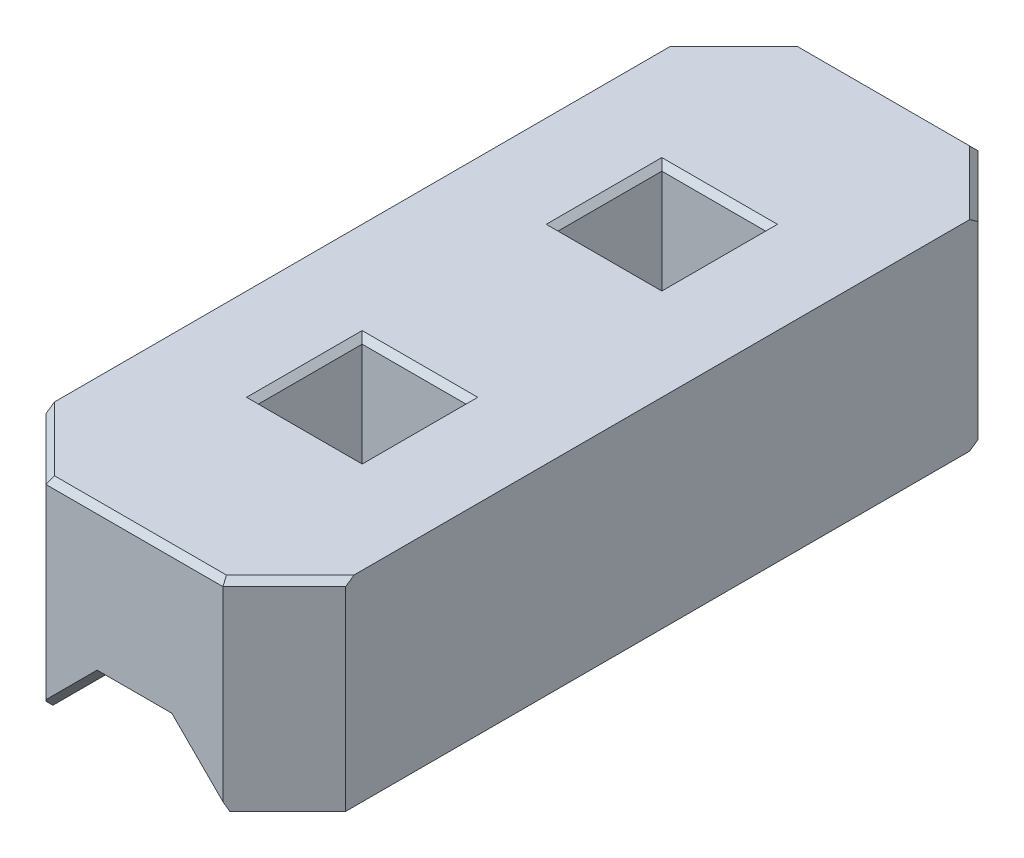
from build123d import *

# Parameters (mm, degrees)
SKETCH5_W           = 0.44
SKETCH5_H           = 0.44
BOSS_EXTRUDE1_DEPTH = 0.85
CUT_EXTRUDE1_REACH  = 5.371
CHAMFER1_SIZE       = 0.025


with BuildPart() as part:
    # Sketch5 → Boss-Extrude1 (new body)
    with BuildSketch(Plane(origin=(0, 0, 0), x_dir=(1, 0, 0), z_dir=(0, 1, 0))):
        Polygon((-0.375, 1.6), (0.375, 1.6), (0.635, 1.34), (0.635, -1.34), (0.375, -1.6), (-0.375, -1.6), (-0.635, -1.34), (-0.635, 1.34), align=None)
        with Locations((0, 0.635)):
            Rectangle(SKETCH5_W, SKETCH5_H, mode=Mode.SUBTRACT)
        with Locations((0, -0.635)):
            Rectangle(SKETCH5_W, SKETCH5_H, mode=Mode.SUBTRACT)
    extrude(amount=BOSS_EXTRUDE1_DEPTH)

    # Cut-Extrude1: up to this face of the body (flat: up to its plane)
    cut_extrude1_end = Plane(part.part.faces().sort_by_distance((0, 0.425, -1.6))[0])
    # Sketch6 → Cut-Extrude1 (cut, up to the picked face)
    with BuildSketch(Plane.XY.offset(1.6), mode=Mode.PRIVATE) as cut_extrude1_sk1:
        Polygon((-0.375, 0), (-0.148, 0.227), (0.148, 0.227), (0.375, 0), align=None)
    cut_extrude1_tool1 = split(extrude(cut_extrude1_sk1.sketch, amount=-CUT_EXTRUDE1_REACH, mode=Mode.PRIVATE), bisect_by=cut_extrude1_end, keep=Keep.BOTH, mode=Mode.PRIVATE)
    add(cut_extrude1_tool1.solids().sort_by(Axis((0, 0.097079, 1.6), (0, 0, -1)))[0], mode=Mode.SUBTRACT)

    # Chamfer1
    # the kernel refuses this chamfer: 0.025 mm, written as the material it takes off along each edge
    with BuildSketch(Plane(origin=(-0.329538638, 0, 1.645461362), x_dir=(0.7068394360706735, -0.027495876610586514, -0.7068394360706735), z_dir=(-0.7071067811865476, 0, -0.7071067811865476)), Plane(origin=(0.329538638, 0.85, -1.645461362), x_dir=(0.019442520806015277, -0.9996219169112966, -0.01944252080601526), z_dir=(0.7071067811865472, 0, 0.7071067811865479))) as chamfer1_piece_1:
        Polygon((CHAMFER1_SIZE * 0.999621916911, -CHAMFER1_SIZE * 0.0274958766106), (-CHAMFER1_SIZE * 0.0274958766106, -CHAMFER1_SIZE * 0.999621916911), (0, 0), align=None)
    extrude(amount=0.496279676, mode=Mode.SUBTRACT)
    with BuildSketch(Plane(origin=(-0.680461362, 0, -1.294538638), x_dir=(-0.01944252080601428, 0.9996219169112966, -0.019442520806014163), z_dir=(0.7071067811865455, 0, -0.7071067811865497)), Plane(origin=(-0.329538638, 0.85, 1.645461362), x_dir=(0.7068394360706735, 0.027495876610587406, -0.7068394360706735), z_dir=(-0.7071067811865476, 0, -0.7071067811865476)), Plane(origin=(0.680461362, 0.85, 1.294538638), x_dir=(-0.7068394360706735, 0.02749587661058749, -0.7068394360706735), z_dir=(-0.7071067811865476, 0, 0.7071067811865476)), Plane(origin=(-0.680461362, 0.85, -1.294538638), x_dir=(0.7068394360706755, 0.02749587661058732, 0.7068394360706715), z_dir=(0.7071067811865455, 0, -0.7071067811865497)), Plane(origin=(0.329538638, 0, -1.645461362), x_dir=(0.019442520806010995, 0.9996219169112968, -0.019442520806010978), z_dir=(0.7071067811865472, 0, 0.7071067811865479))) as chamfer1_piece_2:
        Polygon((CHAMFER1_SIZE * 0.999621916911, CHAMFER1_SIZE * 0.0274958766106), (-CHAMFER1_SIZE * 0.0274958766106, CHAMFER1_SIZE * 0.999621916911), (0, 0), align=None)
    extrude(amount=0.496279676, mode=Mode.SUBTRACT)
    with BuildSketch(Plane(origin=(0.439292075, 0.85, 1.6), x_dir=(0, 0.02749587661058742, -0.9996219169112966), z_dir=(-1, 0, 0))) as chamfer1_piece_3:
        Polygon((CHAMFER1_SIZE * 0.999621916911, CHAMFER1_SIZE * 0.0274958766106), (-CHAMFER1_SIZE * 0.0274958766106, CHAMFER1_SIZE * 0.999621916911), (0, 0), align=None)
    extrude(amount=0.878584149, mode=Mode.SUBTRACT)
    with BuildSketch(Plane(origin=(0.22, 0.85, -0.855), x_dir=(0.9996219169112966, 0.02749587661058736, 0), z_dir=(0, 0, 1)), Plane(origin=(-0.22, 0.85, -0.855), x_dir=(0, 0.027495876610587302, -0.9996219169112966), z_dir=(1, 0, 0)), Plane(origin=(-0.22, 0.85, -0.415), x_dir=(-0.9996219169112966, 0.02749587661058736, 0), z_dir=(0, 0, -1)), Plane(origin=(0.22, 0.85, -0.415), x_dir=(0, 0.027495876610587302, 0.9996219169112966), z_dir=(-1, 0, 0)), Plane(origin=(-0.22, 0.85, 0.855), x_dir=(-0.9996219169112966, 0.02749587661058736, 0), z_dir=(0, 0, -1)), Plane(origin=(0.22, 0.85, 0.855), x_dir=(0, 0.027495876610587302, 0.9996219169112966), z_dir=(-1, 0, 0)), Plane(origin=(0.22, 0.85, 0.415), x_dir=(0.9996219169112966, 0.02749587661058736, 0), z_dir=(0, 0, 1)), Plane(origin=(-0.22, 0.85, 0.415), x_dir=(0, 0.027495876610587302, -0.9996219169112966), z_dir=(1, 0, 0))) as chamfer1_piece_4:
        Polygon((CHAMFER1_SIZE * 0.999621916911, -CHAMFER1_SIZE * 0.0274958766106), (-CHAMFER1_SIZE * 0.0274958766106, -CHAMFER1_SIZE * 0.999621916911), (0, 0), align=None)
    extrude(amount=0.44, mode=Mode.SUBTRACT)
    with BuildSketch(Plane(origin=(-0.439292075, 0.85, -1.6), x_dir=(0, -0.9996219169112966, -0.027495876610587302), z_dir=(1, 0, 0))) as chamfer1_piece_5:
        Polygon((CHAMFER1_SIZE * 0.999621916911, -CHAMFER1_SIZE * 0.0274958766106), (-CHAMFER1_SIZE * 0.0274958766106, -CHAMFER1_SIZE * 0.999621916911), (0, 0), align=None)
    extrude(amount=0.878584149, mode=Mode.SUBTRACT)
    with BuildSketch(Plane(origin=(0.102538638, 0.272461362, 1.6), x_dir=(-0.019442520806014184, -0.01944252080601436, -0.9996219169112966), z_dir=(0.7071067811865508, -0.7071067811865442, 0))) as chamfer1_piece_6_section:
        Polygon((CHAMFER1_SIZE * 0.999621916911, CHAMFER1_SIZE * 0.0274958766106), (-CHAMFER1_SIZE * 0.0274958766106, CHAMFER1_SIZE * 0.999621916911), (0, 0), align=None)
    chamfer1_piece_6 = extrude(amount=0.449610628, mode=Mode.PRIVATE)
    chamfer1_piece_6 = split(chamfer1_piece_6, bisect_by=Plane(origin=(0.292864015, 0.227, 1.591698889), z_dir=(0, -1, 0)), keep=Keep.TOP, mode=Mode.PRIVATE)
    add(chamfer1_piece_6, mode=Mode.SUBTRACT)
    with BuildSketch(Plane(origin=(-0.212292075, 0.227, 1.6), x_dir=(0, 0.9996219169112966, 0.02749587661058733), z_dir=(1, 0, 0))) as chamfer1_piece_7_section:
        Polygon((CHAMFER1_SIZE * 0.999621916911, -CHAMFER1_SIZE * 0.0274958766106), (-CHAMFER1_SIZE * 0.0274958766106, -CHAMFER1_SIZE * 0.999621916911), (0, 0), align=None)
    chamfer1_piece_7 = extrude(amount=0.424584149, mode=Mode.PRIVATE)
    chamfer1_piece_7 = split(chamfer1_piece_7, bisect_by=Plane(origin=(-0.070019575, 0.304980425, 1.591603337), z_dir=(0.707106781186544, -0.7071067811865511, 0)), keep=Keep.TOP, mode=Mode.PRIVATE)
    chamfer1_piece_7 = split(chamfer1_piece_7, bisect_by=Plane(origin=(0.070019575, 0.304980425, 1.591603337), z_dir=(-0.7071067811865442, -0.7071067811865508, 0)), keep=Keep.TOP, mode=Mode.PRIVATE)
    add(chamfer1_piece_7, mode=Mode.SUBTRACT)
    with BuildSketch(Plane(origin=(-0.420461362, -0.045461362, 1.6), x_dir=(0.019442520806013903, -0.019442520806014097, -0.9996219169112966), z_dir=(0.7071067811865511, 0.707106781186544, 0))) as chamfer1_piece_8_section:
        Polygon((CHAMFER1_SIZE * 0.999621916911, CHAMFER1_SIZE * 0.0274958766106), (-CHAMFER1_SIZE * 0.0274958766106, CHAMFER1_SIZE * 0.999621916911), (0, 0), align=None)
    chamfer1_piece_8 = extrude(amount=0.449610628, mode=Mode.PRIVATE)
    chamfer1_piece_8 = split(chamfer1_piece_8, bisect_by=Plane(origin=(-0.292864015, 0.227, 1.591698889), z_dir=(0, -1, 0)), keep=Keep.TOP, mode=Mode.PRIVATE)
    add(chamfer1_piece_8, mode=Mode.SUBTRACT)
    with BuildSketch(Plane(origin=(-0.420461362, -0.045461362, -1.6), x_dir=(-0.7068394360706672, 0.7068394360706742, -0.02749587661072924), z_dir=(0.7071067811865511, 0.707106781186544, 0))) as chamfer1_piece_9_section:
        Polygon((CHAMFER1_SIZE * 0.999621916911, CHAMFER1_SIZE * 0.0274958766107), (-CHAMFER1_SIZE * 0.0274958766006, CHAMFER1_SIZE * 0.999621916912), (0, 0), align=None)
    chamfer1_piece_9 = extrude(amount=0.449610628, mode=Mode.PRIVATE)
    chamfer1_piece_9 = split(chamfer1_piece_9, bisect_by=Plane(origin=(-0.292864015, 0.227, -1.591698889), z_dir=(0, -1, 0)), keep=Keep.TOP, mode=Mode.PRIVATE)
    add(chamfer1_piece_9, mode=Mode.SUBTRACT)
    with BuildSketch(Plane(origin=(-0.212292075, 0.227, -1.6), x_dir=(0, 0.9996219169112966, -0.02749587661058733), z_dir=(1, 0, 0))) as chamfer1_piece_10_section:
        Polygon((CHAMFER1_SIZE * 0.999621916911, CHAMFER1_SIZE * 0.0274958766106), (-CHAMFER1_SIZE * 0.0274958766106, CHAMFER1_SIZE * 0.999621916911), (0, 0), align=None)
    chamfer1_piece_10 = extrude(amount=0.424584149, mode=Mode.PRIVATE)
    chamfer1_piece_10 = split(chamfer1_piece_10, bisect_by=Plane(origin=(-0.070019575, 0.304980425, -1.591603337), z_dir=(0.707106781186544, -0.7071067811865511, 0)), keep=Keep.TOP, mode=Mode.PRIVATE)
    chamfer1_piece_10 = split(chamfer1_piece_10, bisect_by=Plane(origin=(0.070019575, 0.304980425, -1.591603337), z_dir=(-0.7071067811865442, -0.7071067811865508, 0)), keep=Keep.TOP, mode=Mode.PRIVATE)
    add(chamfer1_piece_10, mode=Mode.SUBTRACT)
    with BuildSketch(Plane(origin=(0.102538638, 0.272461362, -1.6), x_dir=(0.7068394360706932, 0.7068394360706998, -0.027495876609399512), z_dir=(0.7071067811865508, -0.7071067811865442, 0))) as chamfer1_piece_11_section:
        Polygon((CHAMFER1_SIZE * 0.999621916911, CHAMFER1_SIZE * 0.0274958766094), (-CHAMFER1_SIZE * 0.0274958766932, CHAMFER1_SIZE * 0.999621916909), (0, 0), align=None)
    chamfer1_piece_11 = extrude(amount=0.449610628, mode=Mode.PRIVATE)
    chamfer1_piece_11 = split(chamfer1_piece_11, bisect_by=Plane(origin=(0.292864015, 0.227, -1.591698889), z_dir=(0, -1, 0)), keep=Keep.TOP, mode=Mode.PRIVATE)
    add(chamfer1_piece_11, mode=Mode.SUBTRACT)
    with BuildSketch(Plane(origin=(0.22, 0.85, -0.919292075), x_dir=(0.9996219169112966, 0.02749587661058736, 0), z_dir=(0, 0, 1))) as chamfer1_piece_12a_section:
        Polygon((CHAMFER1_SIZE * 0.999621916911, -CHAMFER1_SIZE * 0.0274958766106), (-CHAMFER1_SIZE * 0.0274958766106, -CHAMFER1_SIZE * 0.999621916911), (0, 0), align=None)
    chamfer1_piece_12a = extrude(amount=0.504292075, mode=Mode.PRIVATE)
    chamfer1_piece_12a = split(chamfer1_piece_12a, bisect_by=Plane(origin=(0.228244841, 0.841755159, -0.855), z_dir=(0, 0, -1)), keep=Keep.TOP, mode=Mode.PRIVATE)
    with BuildSketch(Plane(origin=(-0.22, 0.85, -0.855), x_dir=(0, 0.027495876610587302, -0.9996219169112966), z_dir=(1, 0, 0))) as chamfer1_piece_12b_section:
        Polygon((CHAMFER1_SIZE * 0.999621916911, -CHAMFER1_SIZE * 0.0274958766106), (-CHAMFER1_SIZE * 0.0274958766106, -CHAMFER1_SIZE * 0.999621916911), (0, 0), align=None)
    chamfer1_piece_12b = extrude(amount=0.504292075, mode=Mode.PRIVATE)
    chamfer1_piece_12b = split(chamfer1_piece_12b, bisect_by=Plane(origin=(0.22, 0.841755159, -0.863244841), z_dir=(1, 0, 0)), keep=Keep.TOP, mode=Mode.PRIVATE)
    chamfer1_piece_12 = chamfer1_piece_12a & chamfer1_piece_12b
    add(chamfer1_piece_12, mode=Mode.SUBTRACT)
    with BuildSketch(Plane(origin=(0.284292075, 0.85, -0.415), x_dir=(0, 0.027495876610587302, 0.9996219169112966), z_dir=(-1, 0, 0))) as chamfer1_piece_13a_section:
        Polygon((CHAMFER1_SIZE * 0.999621916911, -CHAMFER1_SIZE * 0.0274958766106), (-CHAMFER1_SIZE * 0.0274958766106, -CHAMFER1_SIZE * 0.999621916911), (0, 0), align=None)
    chamfer1_piece_13a = extrude(amount=0.504292075, mode=Mode.PRIVATE)
    chamfer1_piece_13a = split(chamfer1_piece_13a, bisect_by=Plane(origin=(0.22, 0.841755159, -0.406755159), z_dir=(1, 0, 0)), keep=Keep.TOP, mode=Mode.PRIVATE)
    with BuildSketch(Plane(origin=(0.22, 0.85, -0.855), x_dir=(0.9996219169112966, 0.02749587661058736, 0), z_dir=(0, 0, 1))) as chamfer1_piece_13b_section:
        Polygon((CHAMFER1_SIZE * 0.999621916911, -CHAMFER1_SIZE * 0.0274958766106), (-CHAMFER1_SIZE * 0.0274958766106, -CHAMFER1_SIZE * 0.999621916911), (0, 0), align=None)
    chamfer1_piece_13b = extrude(amount=0.504292075, mode=Mode.PRIVATE)
    chamfer1_piece_13b = split(chamfer1_piece_13b, bisect_by=Plane(origin=(0.228244841, 0.841755159, -0.415), z_dir=(0, 0, 1)), keep=Keep.TOP, mode=Mode.PRIVATE)
    chamfer1_piece_13 = chamfer1_piece_13a & chamfer1_piece_13b
    add(chamfer1_piece_13, mode=Mode.SUBTRACT)
    with BuildSketch(Plane(origin=(-0.22, 0.85, -0.415), x_dir=(-0.9996219169112966, 0.02749587661058736, 0), z_dir=(0, 0, -1))) as chamfer1_piece_14a_section:
        Polygon((CHAMFER1_SIZE * 0.999621916911, -CHAMFER1_SIZE * 0.0274958766106), (-CHAMFER1_SIZE * 0.0274958766106, -CHAMFER1_SIZE * 0.999621916911), (0, 0), align=None)
    chamfer1_piece_14a = extrude(amount=0.504292075, mode=Mode.PRIVATE)
    chamfer1_piece_14a = split(chamfer1_piece_14a, bisect_by=Plane(origin=(-0.228244841, 0.841755159, -0.855), z_dir=(0, 0, -1)), keep=Keep.TOP, mode=Mode.PRIVATE)
    with BuildSketch(Plane(origin=(-0.284292075, 0.85, -0.855), x_dir=(0, 0.027495876610587302, -0.9996219169112966), z_dir=(1, 0, 0))) as chamfer1_piece_14b_section:
        Polygon((CHAMFER1_SIZE * 0.999621916911, -CHAMFER1_SIZE * 0.0274958766106), (-CHAMFER1_SIZE * 0.0274958766106, -CHAMFER1_SIZE * 0.999621916911), (0, 0), align=None)
    chamfer1_piece_14b = extrude(amount=0.504292075, mode=Mode.PRIVATE)
    chamfer1_piece_14b = split(chamfer1_piece_14b, bisect_by=Plane(origin=(-0.22, 0.841755159, -0.863244841), z_dir=(-1, 0, 0)), keep=Keep.TOP, mode=Mode.PRIVATE)
    chamfer1_piece_14 = chamfer1_piece_14a & chamfer1_piece_14b
    add(chamfer1_piece_14, mode=Mode.SUBTRACT)
    with BuildSketch(Plane(origin=(-0.22, 0.85, -0.350707925), x_dir=(-0.9996219169112966, 0.02749587661058736, 0), z_dir=(0, 0, -1))) as chamfer1_piece_15a_section:
        Polygon((CHAMFER1_SIZE * 0.999621916911, -CHAMFER1_SIZE * 0.0274958766106), (-CHAMFER1_SIZE * 0.0274958766106, -CHAMFER1_SIZE * 0.999621916911), (0, 0), align=None)
    chamfer1_piece_15a = extrude(amount=0.504292075, mode=Mode.PRIVATE)
    chamfer1_piece_15a = split(chamfer1_piece_15a, bisect_by=Plane(origin=(-0.228244841, 0.841755159, -0.415), z_dir=(0, 0, 1)), keep=Keep.TOP, mode=Mode.PRIVATE)
    with BuildSketch(Plane(origin=(0.22, 0.85, -0.415), x_dir=(0, 0.027495876610587302, 0.9996219169112966), z_dir=(-1, 0, 0))) as chamfer1_piece_15b_section:
        Polygon((CHAMFER1_SIZE * 0.999621916911, -CHAMFER1_SIZE * 0.0274958766106), (-CHAMFER1_SIZE * 0.0274958766106, -CHAMFER1_SIZE * 0.999621916911), (0, 0), align=None)
    chamfer1_piece_15b = extrude(amount=0.504292075, mode=Mode.PRIVATE)
    chamfer1_piece_15b = split(chamfer1_piece_15b, bisect_by=Plane(origin=(-0.22, 0.841755159, -0.406755159), z_dir=(-1, 0, 0)), keep=Keep.TOP, mode=Mode.PRIVATE)
    chamfer1_piece_15 = chamfer1_piece_15a & chamfer1_piece_15b
    add(chamfer1_piece_15, mode=Mode.SUBTRACT)
    with BuildSketch(Plane(origin=(-0.22, 0.85, 0.919292075), x_dir=(-0.9996219169112966, 0.02749587661058736, 0), z_dir=(0, 0, -1))) as chamfer1_piece_16a_section:
        Polygon((CHAMFER1_SIZE * 0.999621916911, -CHAMFER1_SIZE * 0.0274958766106), (-CHAMFER1_SIZE * 0.0274958766106, -CHAMFER1_SIZE * 0.999621916911), (0, 0), align=None)
    chamfer1_piece_16a = extrude(amount=0.504292075, mode=Mode.PRIVATE)
    chamfer1_piece_16a = split(chamfer1_piece_16a, bisect_by=Plane(origin=(-0.228244841, 0.841755159, 0.855), z_dir=(0, 0, 1)), keep=Keep.TOP, mode=Mode.PRIVATE)
    with BuildSketch(Plane(origin=(0.22, 0.85, 0.855), x_dir=(0, 0.027495876610587302, 0.9996219169112966), z_dir=(-1, 0, 0))) as chamfer1_piece_16b_section:
        Polygon((CHAMFER1_SIZE * 0.999621916911, -CHAMFER1_SIZE * 0.0274958766106), (-CHAMFER1_SIZE * 0.0274958766106, -CHAMFER1_SIZE * 0.999621916911), (0, 0), align=None)
    chamfer1_piece_16b = extrude(amount=0.504292075, mode=Mode.PRIVATE)
    chamfer1_piece_16b = split(chamfer1_piece_16b, bisect_by=Plane(origin=(-0.22, 0.841755159, 0.863244841), z_dir=(-1, 0, 0)), keep=Keep.TOP, mode=Mode.PRIVATE)
    chamfer1_piece_16 = chamfer1_piece_16a & chamfer1_piece_16b
    add(chamfer1_piece_16, mode=Mode.SUBTRACT)
    with BuildSketch(Plane(origin=(-0.22, 0.85, 0.855), x_dir=(-0.9996219169112966, 0.02749587661058736, 0), z_dir=(0, 0, -1))) as chamfer1_piece_17a_section:
        Polygon((CHAMFER1_SIZE * 0.999621916911, -CHAMFER1_SIZE * 0.0274958766106), (-CHAMFER1_SIZE * 0.0274958766106, -CHAMFER1_SIZE * 0.999621916911), (0, 0), align=None)
    chamfer1_piece_17a = extrude(amount=0.504292075, mode=Mode.PRIVATE)
    chamfer1_piece_17a = split(chamfer1_piece_17a, bisect_by=Plane(origin=(-0.228244841, 0.841755159, 0.415), z_dir=(0, 0, -1)), keep=Keep.TOP, mode=Mode.PRIVATE)
    with BuildSketch(Plane(origin=(-0.284292075, 0.85, 0.415), x_dir=(0, 0.027495876610587302, -0.9996219169112966), z_dir=(1, 0, 0))) as chamfer1_piece_17b_section:
        Polygon((CHAMFER1_SIZE * 0.999621916911, -CHAMFER1_SIZE * 0.0274958766106), (-CHAMFER1_SIZE * 0.0274958766106, -CHAMFER1_SIZE * 0.999621916911), (0, 0), align=None)
    chamfer1_piece_17b = extrude(amount=0.504292075, mode=Mode.PRIVATE)
    chamfer1_piece_17b = split(chamfer1_piece_17b, bisect_by=Plane(origin=(-0.22, 0.841755159, 0.406755159), z_dir=(-1, 0, 0)), keep=Keep.TOP, mode=Mode.PRIVATE)
    chamfer1_piece_17 = chamfer1_piece_17a & chamfer1_piece_17b
    add(chamfer1_piece_17, mode=Mode.SUBTRACT)
    with BuildSketch(Plane(origin=(0.284292075, 0.85, 0.855), x_dir=(0, 0.027495876610587302, 0.9996219169112966), z_dir=(-1, 0, 0))) as chamfer1_piece_18a_section:
        Polygon((CHAMFER1_SIZE * 0.999621916911, -CHAMFER1_SIZE * 0.0274958766106), (-CHAMFER1_SIZE * 0.0274958766106, -CHAMFER1_SIZE * 0.999621916911), (0, 0), align=None)
    chamfer1_piece_18a = extrude(amount=0.504292075, mode=Mode.PRIVATE)
    chamfer1_piece_18a = split(chamfer1_piece_18a, bisect_by=Plane(origin=(0.22, 0.841755159, 0.863244841), z_dir=(1, 0, 0)), keep=Keep.TOP, mode=Mode.PRIVATE)
    with BuildSketch(Plane(origin=(0.22, 0.85, 0.415), x_dir=(0.9996219169112966, 0.02749587661058736, 0), z_dir=(0, 0, 1))) as chamfer1_piece_18b_section:
        Polygon((CHAMFER1_SIZE * 0.999621916911, -CHAMFER1_SIZE * 0.0274958766106), (-CHAMFER1_SIZE * 0.0274958766106, -CHAMFER1_SIZE * 0.999621916911), (0, 0), align=None)
    chamfer1_piece_18b = extrude(amount=0.504292075, mode=Mode.PRIVATE)
    chamfer1_piece_18b = split(chamfer1_piece_18b, bisect_by=Plane(origin=(0.228244841, 0.841755159, 0.855), z_dir=(0, 0, 1)), keep=Keep.TOP, mode=Mode.PRIVATE)
    chamfer1_piece_18 = chamfer1_piece_18a & chamfer1_piece_18b
    add(chamfer1_piece_18, mode=Mode.SUBTRACT)
    with BuildSketch(Plane(origin=(0.22, 0.85, 0.350707925), x_dir=(0.9996219169112966, 0.02749587661058736, 0), z_dir=(0, 0, 1))) as chamfer1_piece_19a_section:
        Polygon((CHAMFER1_SIZE * 0.999621916911, -CHAMFER1_SIZE * 0.0274958766106), (-CHAMFER1_SIZE * 0.0274958766106, -CHAMFER1_SIZE * 0.999621916911), (0, 0), align=None)
    chamfer1_piece_19a = extrude(amount=0.504292075, mode=Mode.PRIVATE)
    chamfer1_piece_19a = split(chamfer1_piece_19a, bisect_by=Plane(origin=(0.228244841, 0.841755159, 0.415), z_dir=(0, 0, -1)), keep=Keep.TOP, mode=Mode.PRIVATE)
    with BuildSketch(Plane(origin=(-0.22, 0.85, 0.415), x_dir=(0, 0.027495876610587302, -0.9996219169112966), z_dir=(1, 0, 0))) as chamfer1_piece_19b_section:
        Polygon((CHAMFER1_SIZE * 0.999621916911, -CHAMFER1_SIZE * 0.0274958766106), (-CHAMFER1_SIZE * 0.0274958766106, -CHAMFER1_SIZE * 0.999621916911), (0, 0), align=None)
    chamfer1_piece_19b = extrude(amount=0.504292075, mode=Mode.PRIVATE)
    chamfer1_piece_19b = split(chamfer1_piece_19b, bisect_by=Plane(origin=(0.22, 0.841755159, 0.406755159), z_dir=(1, 0, 0)), keep=Keep.TOP, mode=Mode.PRIVATE)
    chamfer1_piece_19 = chamfer1_piece_19a & chamfer1_piece_19b
    add(chamfer1_piece_19, mode=Mode.SUBTRACT)
    with BuildSketch(Plane(origin=(0.102538638, 0.272461362, 1.6), x_dir=(-0.019442520806014184, -0.01944252080601436, -0.9996219169112966), z_dir=(0.7071067811865508, -0.7071067811865442, 0))) as chamfer1_piece_20a_section:
        Polygon((CHAMFER1_SIZE * 0.999621916911, CHAMFER1_SIZE * 0.0274958766106), (-CHAMFER1_SIZE * 0.0274958766106, CHAMFER1_SIZE * 0.999621916911), (0, 0), align=None)
    chamfer1_piece_20a = extrude(amount=0.449610628, mode=Mode.PRIVATE)
    chamfer1_piece_20a = split(chamfer1_piece_20a, bisect_by=Plane(origin=(0.134594641, 0.227, 1.592047672), z_dir=(0, 1, 0)), keep=Keep.TOP, mode=Mode.PRIVATE)
    with BuildSketch(Plane(origin=(-0.212292075, 0.227, 1.6), x_dir=(0, 0.9996219169112966, 0.02749587661058733), z_dir=(1, 0, 0))) as chamfer1_piece_20b_section:
        Polygon((CHAMFER1_SIZE * 0.999621916911, -CHAMFER1_SIZE * 0.0274958766106), (-CHAMFER1_SIZE * 0.0274958766106, -CHAMFER1_SIZE * 0.999621916911), (0, 0), align=None)
    chamfer1_piece_20b = extrude(amount=0.424584149, mode=Mode.PRIVATE)
    chamfer1_piece_20b = split(chamfer1_piece_20b, bisect_by=Plane(origin=(0.15747902, 0.21752098, 1.592047672), z_dir=(0.7071067811865442, 0.7071067811865508, 0)), keep=Keep.TOP, mode=Mode.PRIVATE)
    chamfer1_piece_20 = chamfer1_piece_20a & chamfer1_piece_20b
    add(chamfer1_piece_20, mode=Mode.SUBTRACT)
    with BuildSketch(Plane(origin=(-0.420461362, -0.045461362, 1.6), x_dir=(0.019442520806013903, -0.019442520806014097, -0.9996219169112966), z_dir=(0.7071067811865511, 0.707106781186544, 0))) as chamfer1_piece_21a_section:
        Polygon((CHAMFER1_SIZE * 0.999621916911, CHAMFER1_SIZE * 0.0274958766106), (-CHAMFER1_SIZE * 0.0274958766106, CHAMFER1_SIZE * 0.999621916911), (0, 0), align=None)
    chamfer1_piece_21a = extrude(amount=0.449610628, mode=Mode.PRIVATE)
    chamfer1_piece_21a = split(chamfer1_piece_21a, bisect_by=Plane(origin=(-0.134594641, 0.227, 1.592047672), z_dir=(0, 1, 0)), keep=Keep.TOP, mode=Mode.PRIVATE)
    with BuildSketch(Plane(origin=(-0.212292075, 0.227, 1.6), x_dir=(0, 0.9996219169112966, 0.02749587661058733), z_dir=(1, 0, 0))) as chamfer1_piece_21b_section:
        Polygon((CHAMFER1_SIZE * 0.999621916911, -CHAMFER1_SIZE * 0.0274958766106), (-CHAMFER1_SIZE * 0.0274958766106, -CHAMFER1_SIZE * 0.999621916911), (0, 0), align=None)
    chamfer1_piece_21b = extrude(amount=0.424584149, mode=Mode.PRIVATE)
    chamfer1_piece_21b = split(chamfer1_piece_21b, bisect_by=Plane(origin=(-0.15747902, 0.21752098, 1.592047672), z_dir=(-0.707106781186544, 0.7071067811865511, 0)), keep=Keep.TOP, mode=Mode.PRIVATE)
    chamfer1_piece_21 = chamfer1_piece_21a & chamfer1_piece_21b
    add(chamfer1_piece_21, mode=Mode.SUBTRACT)
    with BuildSketch(Plane(origin=(-0.420461362, -0.045461362, -1.6), x_dir=(-0.7068394360706672, 0.7068394360706742, -0.02749587661072924), z_dir=(0.7071067811865511, 0.707106781186544, 0))) as chamfer1_piece_22a_section:
        Polygon((CHAMFER1_SIZE * 0.999621916911, CHAMFER1_SIZE * 0.0274958766107), (-CHAMFER1_SIZE * 0.0274958766006, CHAMFER1_SIZE * 0.999621916912), (0, 0), align=None)
    chamfer1_piece_22a = extrude(amount=0.449610628, mode=Mode.PRIVATE)
    chamfer1_piece_22a = split(chamfer1_piece_22a, bisect_by=Plane(origin=(-0.134594641, 0.227, -1.592047672), z_dir=(0, 1, 0)), keep=Keep.TOP, mode=Mode.PRIVATE)
    with BuildSketch(Plane(origin=(-0.212292075, 0.227, -1.6), x_dir=(0, 0.9996219169112966, -0.02749587661058733), z_dir=(1, 0, 0))) as chamfer1_piece_22b_section:
        Polygon((CHAMFER1_SIZE * 0.999621916911, CHAMFER1_SIZE * 0.0274958766106), (-CHAMFER1_SIZE * 0.0274958766106, CHAMFER1_SIZE * 0.999621916911), (0, 0), align=None)
    chamfer1_piece_22b = extrude(amount=0.424584149, mode=Mode.PRIVATE)
    chamfer1_piece_22b = split(chamfer1_piece_22b, bisect_by=Plane(origin=(-0.15747902, 0.21752098, -1.592047672), z_dir=(-0.707106781186544, 0.7071067811865511, 0)), keep=Keep.TOP, mode=Mode.PRIVATE)
    chamfer1_piece_22 = chamfer1_piece_22a & chamfer1_piece_22b
    add(chamfer1_piece_22, mode=Mode.SUBTRACT)
    with BuildSketch(Plane(origin=(-0.212292075, 0.227, -1.6), x_dir=(0, 0.9996219169112966, -0.02749587661058733), z_dir=(1, 0, 0))) as chamfer1_piece_23a_section:
        Polygon((CHAMFER1_SIZE * 0.999621916911, CHAMFER1_SIZE * 0.0274958766106), (-CHAMFER1_SIZE * 0.0274958766106, CHAMFER1_SIZE * 0.999621916911), (0, 0), align=None)
    chamfer1_piece_23a = extrude(amount=0.424584149, mode=Mode.PRIVATE)
    chamfer1_piece_23a = split(chamfer1_piece_23a, bisect_by=Plane(origin=(0.15747902, 0.21752098, -1.592047672), z_dir=(0.7071067811865442, 0.7071067811865508, 0)), keep=Keep.TOP, mode=Mode.PRIVATE)
    with BuildSketch(Plane(origin=(0.102538638, 0.272461362, -1.6), x_dir=(0.7068394360706932, 0.7068394360706998, -0.027495876609399512), z_dir=(0.7071067811865508, -0.7071067811865442, 0))) as chamfer1_piece_23b_section:
        Polygon((CHAMFER1_SIZE * 0.999621916911, CHAMFER1_SIZE * 0.0274958766094), (-CHAMFER1_SIZE * 0.0274958766932, CHAMFER1_SIZE * 0.999621916909), (0, 0), align=None)
    chamfer1_piece_23b = extrude(amount=0.449610628, mode=Mode.PRIVATE)
    chamfer1_piece_23b = split(chamfer1_piece_23b, bisect_by=Plane(origin=(0.134594641, 0.227, -1.592047672), z_dir=(0, 1, 0)), keep=Keep.TOP, mode=Mode.PRIVATE)
    chamfer1_piece_23 = chamfer1_piece_23a & chamfer1_piece_23b
    add(chamfer1_piece_23, mode=Mode.SUBTRACT)


solid = part.part
